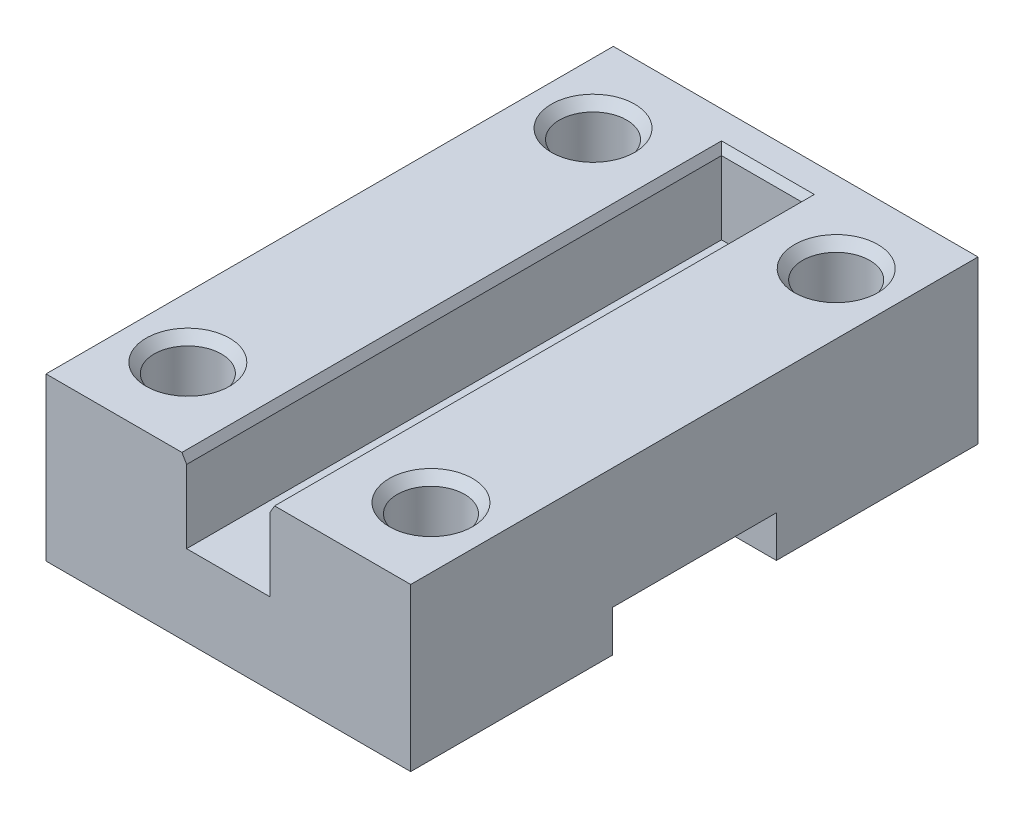
from build123d import *
from OCP.BRepFilletAPI import BRepFilletAPI_MakeChamfer

# Parameters (mm, degrees)
SKETCH1_W               = 45
SKETCH1_H               = 70
BOSS_EXTRUDE1_DEPTH     = 10
CUT_EXTRUDE1_DEPTH      = 58.879184514
CUT_EXTRUDE1_DEPTH_BACK = 58.879184514
SKETCH2_W               = 20.25
SKETCH2_H               = 5.1
SKETCH3_R               = 4.15
CUT_EXTRUDE2_DEPTH      = 43.793106922
SKETCH5_R               = 4.15
BOSS_EXTRUDE2_DEPTH     = 10
CHAMFER1_SIZE           = 1
CHAMFER1_SIZE2          = 1.191753593
CHAMFER2_SIZE           = 1
CHAMFER2_SIZE2          = 0.577350269


with BuildPart() as part:
    # Sketch1 → Boss-Extrude1 (new body)
    with BuildSketch(Plane(origin=(0, 0, 0), x_dir=(1, 0, 0), z_dir=(0, 1, 0))):
        Rectangle(SKETCH1_W, SKETCH1_H)
    extrude(amount=BOSS_EXTRUDE1_DEPTH)

    # Sketch2 → Cut-Extrude1 (cut, two sides: drawn at the far end of the back side and taken through both)
    with BuildSketch(Plane(origin=(22.5, 0, 0), x_dir=(0, 0, -1), z_dir=(1, 0, 0)).offset(-CUT_EXTRUDE1_DEPTH_BACK)):
        with Locations((0, 2.55)):
            Rectangle(SKETCH2_W, SKETCH2_H)
    extrude(amount=CUT_EXTRUDE1_DEPTH + CUT_EXTRUDE1_DEPTH_BACK, mode=Mode.SUBTRACT)

    # Sketch3 → Cut-Extrude2 (cut, through all)
    with BuildSketch(Plane.XZ):
        with Locations((15, 25)):
            Circle(SKETCH3_R)
        with Locations((15, -25)):
            Circle(SKETCH3_R)
        with Locations((-15, -25)):
            Circle(SKETCH3_R)
        with Locations((-15, 25)):
            Circle(SKETCH3_R)
    extrude(amount=-CUT_EXTRUDE2_DEPTH, mode=Mode.SUBTRACT)

    # Sketch5 → Boss-Extrude2 (add)
    with BuildSketch(Plane(origin=(0, 10, 0), x_dir=(1, 0, 0), z_dir=(0, 1, 0))):
        Polygon((-5.15, -35), (-22.5, -35), (-22.5, 35), (22.5, 35), (22.5, -35), (5.15, -35), (5.130229348, -34.949305848), (5.15, 31), (-5.15, 31), align=None)
        with Locations((-15, 25)):
            Circle(SKETCH5_R, mode=Mode.SUBTRACT)
        with Locations((15, 25)):
            Circle(SKETCH5_R, mode=Mode.SUBTRACT)
        with Locations((15, -25)):
            Circle(SKETCH5_R, mode=Mode.SUBTRACT)
        with Locations((-15, -25)):
            Circle(SKETCH5_R, mode=Mode.SUBTRACT)
    extrude(amount=BOSS_EXTRUDE2_DEPTH)

    # Chamfer1
    chamfer1_edges = [part.edges().sort_by_distance(p)[0] for p in [
        (10.85, 20, 25),
        (-19.15, 20, 25),
        (-19.15, 20, -25),
        (10.85, 20, -25),
    ]]
    chamfer1_side = [part.faces().sort_by_distance(p)[0] for p in [
        (-13.825, 20, 34.167834151),
    ]]
    chamfer(chamfer1_edges, length=CHAMFER1_SIZE, length2=CHAMFER1_SIZE2, reference=chamfer1_side[0])

    # Chamfer2: one chamfer whose edges measure the first distance from different faces: ONE call of the kernel's chamfer builder (chamfer() names one face for all edges)
    chamfer2_edges_1 = [part.edges().sort_by_distance(p)[0] for p in [
        (-5.15, 20, 2),
    ]]
    chamfer2_side_1 = [part.faces().sort_by_distance(p)[0] for p in [
        (-5.15, 15, 2),
    ]]
    chamfer2_edges_2 = [part.edges().sort_by_distance(p)[0] for p in [
        (0, 20, -31),
    ]]
    chamfer2_side_2 = [part.faces().sort_by_distance(p)[0] for p in [
        (0, 15, -31),
    ]]
    chamfer2_edges_3 = [part.edges().sort_by_distance(p)[0] for p in [
        (5.140114674, 20, 1.974652924),
    ]]
    chamfer2_side_3 = [part.faces().sort_by_distance(p)[0] for p in [
        (5.140114674, 15, 1.974652924),
    ]]
    chamfer2 = BRepFilletAPI_MakeChamfer(part.part.solid().wrapped)
    for e in chamfer2_edges_1:
        chamfer2.Add(CHAMFER2_SIZE, CHAMFER2_SIZE2, e.wrapped, chamfer2_side_1[0].wrapped)  # the first distance lies on this face
    for e in chamfer2_edges_2:
        chamfer2.Add(CHAMFER2_SIZE, CHAMFER2_SIZE2, e.wrapped, chamfer2_side_2[0].wrapped)  # the first distance lies on this face
    for e in chamfer2_edges_3:
        chamfer2.Add(CHAMFER2_SIZE, CHAMFER2_SIZE2, e.wrapped, chamfer2_side_3[0].wrapped)  # the first distance lies on this face
    add(Compound.cast(chamfer2.Shape()), mode=Mode.REPLACE)


solid = part.part
